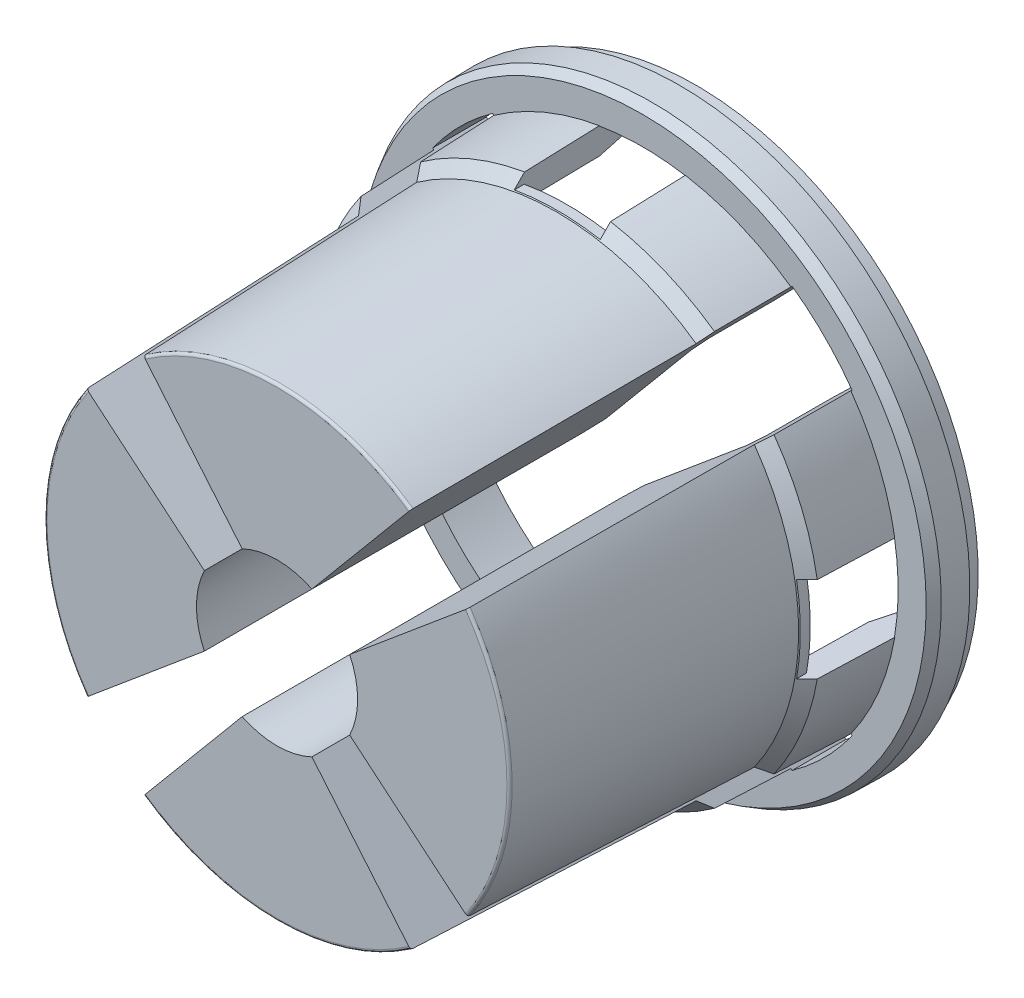
from build123d import *

# Parameters (mm, degrees)
SKETCH1_R                              = 5.4
COLLAR_DEPTH                           = 1
COLLAR_TAPER                           = 1
SKETCH2_R                              = 4.6
SLEEVE_OUTSIDE_DEPTH                   = 7.8
SLEEVE_OUTSIDE_TAPER                   = 2
SKETCH11_R                             = 4.8
EXTRUDE1_DEPTH                         = 2.6
EXTRUDE1_DRAFT                         = -2
CHAMFER3_SIZE2                         = 0.2
CHAMFER3_SIZE                          = 0.207363191
SKETCH3_R                              = 4.3
ENTRENCE_OVERSIZE_HOLE_FOR_SHAFT_DEPTH = 2.4
ENTRENCE_OVERSIZE_HOLE_FOR_SHAFT_DRAFT = -1
CHAMFER4_SIZE                          = 0.2
CHAMFER4_SIZE2                         = 0.203584038
CHAMFER1_SIZE                          = 0.25
CHAMFER1_SIZE2                         = 0.998179416
SKETCH6_R                              = 1.5
SHAFT_HOLE_DEPTH                       = 11.916043239
CHAMFER_TO_SHAFT_HOLE_SIZE             = 0.1
CHAMFER_TO_SHAFT_HOLE_SIZE2            = 0.373205081
SLOTS_START                            = -10
SLOTS_IN_SLEEVE_1_DEPTH                = 21.225458425
CIRPATTERN2_COUNT                      = 4
FILLET_OUTSIDE_SLEVE_END_R             = 0.05
SMALL_SLOT_1_REACH                     = 12.916
CIRPATTERN1_COUNT                      = 4
CHAMFER2_SIZE                          = 0.178632058
CHAMFER2_SIZE_2                        = 0.1
CUT_EXTRUDE1_DEPTH                     = 10
CIRPATTERN3_COUNT                      = 4
SKETCH14_OUTSIDE_W                     = 16.23
SKETCH14_OUTSIDE_H                     = 16.23
SKETCH14_OUTSIDE_R                     = 5.25
CUT_EXTRUDE2_DEPTH                     = 0.3


# Some blends are built 0.0001 mm under size
with BuildPart() as part:
    # Sketch1 → Collar (new body)
    with BuildSketch(Plane.XY):
        Circle(SKETCH1_R)
    extrude(amount=COLLAR_DEPTH, taper=COLLAR_TAPER)

    # Sketch2 → Sleeve outside (add)
    with BuildSketch(Plane.XY):
        Circle(SKETCH2_R)
    extrude(amount=SLEEVE_OUTSIDE_DEPTH, taper=SLEEVE_OUTSIDE_TAPER)


with BuildPart() as extrude1_tool:
    # Sketch11 → Extrude1 (with draft: the straight prism first)
    with BuildSketch(Plane(origin=(0, 0, 0), x_dir=(-1, 0, 0), z_dir=(0, 0, -1))):
        Circle(SKETCH11_R)
    extrude(amount=-EXTRUDE1_DEPTH)
    # Extrude1: the draft: its side faces are tilted about the plane it starts from
    extrude1_sides = [extrude1_tool.faces().sort_by_distance(p)[0] for p in [
        (4.8, 0, 1.3),
    ]]
    draft(extrude1_sides, Plane(origin=(0, 0, 0), x_dir=(-1, 0, 0), z_dir=(0, 0, -1)), EXTRUDE1_DRAFT)


with BuildPart() as part_1:
    add(part.part)

    # Extrude1: add extrude1_tool
    add(extrude1_tool.part)

    # Chamfer3
    chamfer3_edges = [part_1.edges().sort_by_distance(p)[0] for p in [
        (4.709205999, 0, 2.6),
    ]]
    chamfer3_side = [part_1.faces().sort_by_distance(p)[0] for p in [
        (4.709345597, 0, 2.596002437),
    ]]
    chamfer(chamfer3_edges, length=CHAMFER3_SIZE - 0.0001, length2=CHAMFER3_SIZE2 - 0.0001, reference=chamfer3_side[0])  # a hair under: the kernel refuses the full size


with BuildPart() as entrence_oversize_hole_for_shaft_tool:
    # Sketch3 → Entrence oversize hole for shaft (with draft: the straight prism first)
    with BuildSketch(Plane(origin=(0, 0, 0), x_dir=(-1, 0, 0), z_dir=(0, 0, -1))):
        Circle(SKETCH3_R)
    extrude(amount=-ENTRENCE_OVERSIZE_HOLE_FOR_SHAFT_DEPTH)
    # Entrence oversize hole for shaft: the draft: its side faces are tilted about the plane it starts from
    entrence_oversize_hole_for_shaft_sides = [entrence_oversize_hole_for_shaft_tool.faces().sort_by_distance(p)[0] for p in [
        (4.3, 0, 1.2),
    ]]
    draft(entrence_oversize_hole_for_shaft_sides, Plane(origin=(0, 0, 0), x_dir=(-1, 0, 0), z_dir=(0, 0, -1)), ENTRENCE_OVERSIZE_HOLE_FOR_SHAFT_DRAFT)


with BuildPart() as part_2:
    add(part_1.part)

    # Entrence oversize hole for shaft: cut by entrence_oversize_hole_for_shaft_tool
    add(entrence_oversize_hole_for_shaft_tool.part, mode=Mode.SUBTRACT)

    # Chamfer4
    chamfer4_edges = [part_2.edges().sort_by_distance(p)[0] for p in [
        (4.258107844, 0, 2.4),
    ]]
    chamfer4_side = [part_2.faces().sort_by_distance(p)[0] for p in [
        (4.279053922, 0, 1.2),
    ]]
    chamfer(chamfer4_edges, length=CHAMFER4_SIZE, length2=CHAMFER4_SIZE2, reference=chamfer4_side[0])

    # Chamfer1
    chamfer1_edges = [part_2.edges().sort_by_distance(p)[0] for p in [
        (4.3, 0, 0),
    ]]
    chamfer1_side = [part_2.faces().sort_by_distance(p)[0] for p in [
        (-5.247264935, 0, 0),
    ]]
    chamfer(chamfer1_edges, length=CHAMFER1_SIZE, length2=CHAMFER1_SIZE2, reference=chamfer1_side[0])

    # Sketch6 → Shaft hole (cut, through all)
    with BuildSketch(Plane.XY.offset(7.8)):
        Circle(SKETCH6_R)
    extrude(amount=-SHAFT_HOLE_DEPTH, mode=Mode.SUBTRACT)

    # Chamfer to shaft hole
    chamfer_to_shaft_hole_edges = [part_2.edges().sort_by_distance(p)[0] for p in [
        (-1.5, 0, 2.4),
    ]]
    chamfer_to_shaft_hole_side = [part_2.faces().sort_by_distance(p)[0] for p in [
        (3.939844555, 0, 2.4),
    ]]
    chamfer(chamfer_to_shaft_hole_edges, length=CHAMFER_TO_SHAFT_HOLE_SIZE, length2=CHAMFER_TO_SHAFT_HOLE_SIZE2, reference=chamfer_to_shaft_hole_side[0])

    # Sketch4 → Slots in sleeve(1) (cut)
    with BuildSketch(Plane.XY.offset(1).offset(SLOTS_START)):
        with BuildLine():
            Line((-3.90395474, 2.78460661), (-0.726306325, 0.125254527))
            Line((-0.726306325, 0.125254527), (-0.032481324, 0.032481324))
            Line((-0.032481324, 0.032481324), (-0.125254527, 0.726306325))
            Line((-0.125254527, 0.726306325), (-2.78460661, 3.90395474))
            ThreePointArc((-2.78460661, 3.90395474), (-3.391238534, 3.391238534), (-3.90395474, 2.78460661))
        make_face()
    slots_in_sleeve_1 = extrude(amount=SLOTS_IN_SLEEVE_1_DEPTH, mode=Mode.SUBTRACT)

    # CirPattern2: Slots in sleeve(1) ×4 about axis
    cirpattern2_axis = Axis((0, 0, 0), (0, 0, 1))
    for i in range(1, CIRPATTERN2_COUNT):
        add(slots_in_sleeve_1.rotate(cirpattern2_axis, i * 360 / CIRPATTERN2_COUNT), mode=Mode.SUBTRACT)

    # Fillet outside sleve end
    fillet_outside_sleve_end_edges = [part_2.edges().sort_by_distance(p)[0] for p in [
        (-4.327617998, 0, 7.8),
        (0, -4.327617998, 7.8),
        (4.327617998, 0, 7.8),
        (0, 4.327617998, 7.8),
    ]]
    fillet(fillet_outside_sleve_end_edges, radius=FILLET_OUTSIDE_SLEVE_END_R)

    # small slot(1): up to this face of the body (flat: up to its plane)
    small_slot_1_end = Plane(part_2.part.faces().sort_by_distance((0, 2.880875653, 2.4))[0])
    # Sketch7 → small slot(1) (cut, up to the picked face)
    with BuildSketch(Plane(origin=(0, 0, 0), x_dir=(-1, 0, 0), z_dir=(0, 0, -1)), mode=Mode.PRIVATE) as small_slot_1_sk1:
        with BuildLine():
            Line((-0.8, 1.532635983), (0.8, 1.532635983))
            Line((0.8, 1.532635983), (0.8, 4.692291551))
            ThreePointArc((0.8, 4.692291551), (0, 4.76), (-0.8, 4.692291551))
            Line((-0.8, 4.692291551), (-0.8, 1.532635983))
        make_face()
    small_slot_1_tool1 = split(extrude(small_slot_1_sk1.sketch, amount=-SMALL_SLOT_1_REACH, mode=Mode.PRIVATE), bisect_by=small_slot_1_end, keep=Keep.BOTH, mode=Mode.PRIVATE)
    small_slot_1 = small_slot_1_tool1.solids().sort_by(Axis((0, 3.135129, 0), (0, 0, 1)))[0]
    add(small_slot_1, mode=Mode.SUBTRACT)

    # CirPattern1: small slot(1) ×4 about axis
    cirpattern1_axis = Axis((0, 0, 0), (0, 0, 1))
    for i in range(1, CIRPATTERN1_COUNT):
        add(small_slot_1.rotate(cirpattern1_axis, i * 360 / CIRPATTERN1_COUNT), mode=Mode.SUBTRACT)

    # Chamfer2
    # the kernel refuses this chamfer: 0.178632058, 0.1 mm, written as the material it takes off along each edge
    with BuildSketch(Plane(origin=(0, 0, 1), x_dir=(1, 0, 0), z_dir=(0, 1, 0))) as chamfer2_piece_1:
        Polygon((5.382544935 + CHAMFER2_SIZE * 0.0174524064727, CHAMFER2_SIZE * 0.999847697184), (5.382544935 - CHAMFER2_SIZE_2, 0), (5.382544935, 0), align=None)
    revolve(axis=Axis((0, 0, 1), (0, 0, -1)), mode=Mode.SUBTRACT)

    # Sketch12 → Cut-Extrude1 (cut)
    with BuildSketch(Plane.XY.offset(1)):
        with BuildLine():
            Line((-0.8, 5.459805817), (-0.8, 4.453720355))
            ThreePointArc((-0.8, 4.453720355), (0, 4.525), (0.8, 4.453720355))
            Line((0.8, 4.453720355), (0.8, 5.459805817))
            Line((0.8, 5.459805817), (-0.8, 5.459805817))
        make_face()
    cut_extrude1 = extrude(amount=CUT_EXTRUDE1_DEPTH, mode=Mode.SUBTRACT)

    # CirPattern3: Cut-Extrude1 ×4 about axis
    cirpattern3_axis = Axis((0, 0, -5.040257136), (0, 0, 1))
    for i in range(1, CIRPATTERN3_COUNT):
        add(cut_extrude1.rotate(cirpattern3_axis, i * 360 / CIRPATTERN3_COUNT), mode=Mode.SUBTRACT)

    # Sketch14 outside → Cut-Extrude2 (cut)
    with BuildSketch(Plane(origin=(0, 0, 0), x_dir=(-1, 0, 0), z_dir=(0, 0, -1))):
        Rectangle(SKETCH14_OUTSIDE_W, SKETCH14_OUTSIDE_H)
        Circle(SKETCH14_OUTSIDE_R, mode=Mode.SUBTRACT)
    extrude(amount=-CUT_EXTRUDE2_DEPTH, mode=Mode.SUBTRACT)


solid = part_2.part
